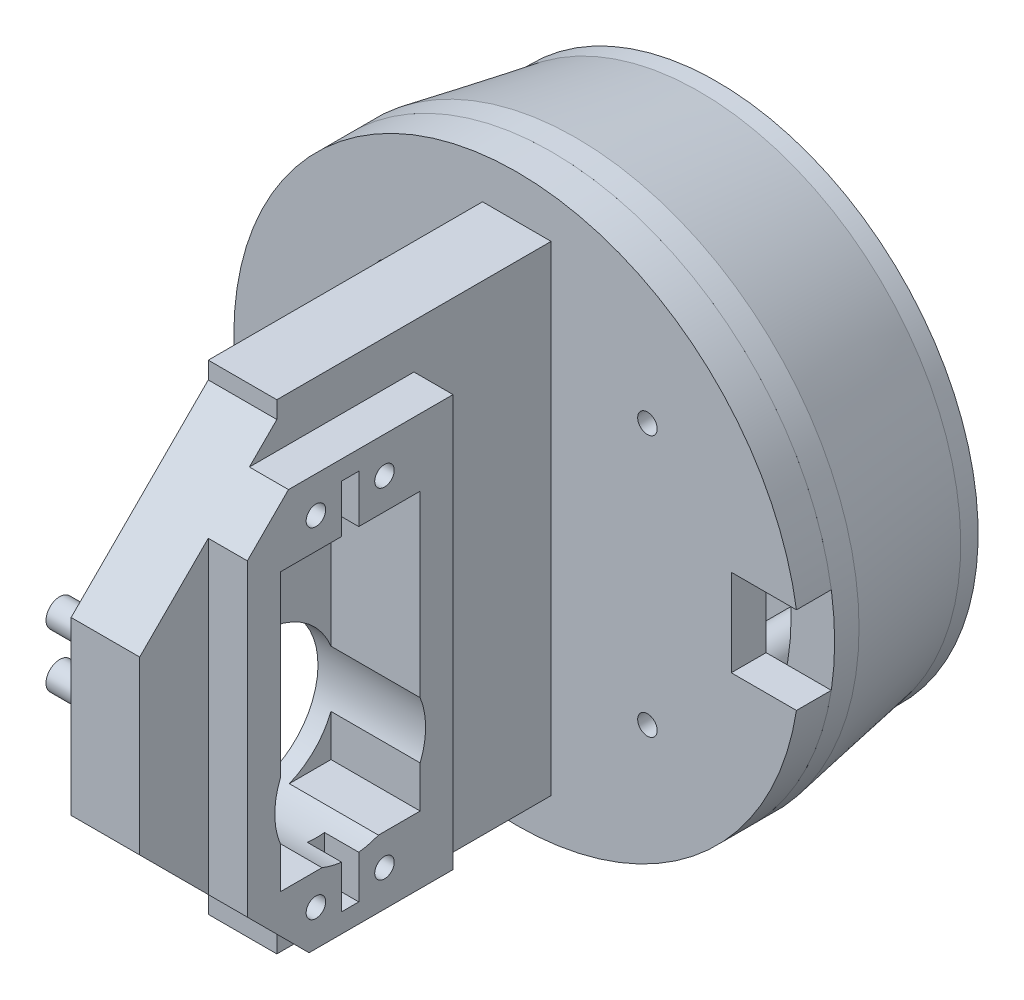
from build123d import *

# Parameters (mm, degrees)
SKETCH2_R                      = 41.27500000000001
SKETCH2_R_2                    = 34.925000000000004
BOSS_EXTRUDE1_DEPTH            = 3.555999999999654
SKETCH54_R                     = 41.27500000000001
SKETCH54_R_2                   = 34.92500000000001
BOSS_EXTRUDE2_DEPTH            = 25.4
BOSS_EXTRUDE2_TAPER            = 10.000000000000021
BOSS_EXTRUDE3_START            = -18.006319777
BOSS_EXTRUDE3_OUTLINE_R        = 38.1
BOSS_EXTRUDE3_DEPTH            = 3.81
BOSS_EXTRUDE5_REACH            = 72.778
SKETCH63_R                     = 3.175000000000002
SKETCH63_R_2                   = 3.175000000000009
SKETCH63_R_3                   = 3.1750000000000056
F_3_0MM_DOWEL_HOLE4_D          = 2.85
F_3_0MM_DOWEL_HOLE4_DEPTH      = 6.858
F_3_0MM_DOWEL_HOLE3_D          = 2.999994
CUT_EXTRUDE2_REACH             = 126.878
SKETCH58_W                     = 12.700000000000001
SKETCH58_H                     = 21.266668123278706
SKETCH60_R                     = 1.4249999999999978
SKETCH60_R_2                   = 1.4250000000000005
CUT_EXTRUDE4_DEPTH             = 70.71188168256496
SKETCH64_R                     = 1.425000000000001
SKETCH64_R_2                   = 1.4249999999999978
SKETCH64_R_3                   = 1.499996999999999
BOSS_EXTRUDE6_DEPTH            = 2.54
SKETCH67_R                     = 41.27500000000003
SKETCH67_R_2                   = 1.4249999999999985
SKETCH67_R_3                   = 1.4249999999999976
BOSS_EXTRUDE7_DEPTH            = 5.08
SKETCH68_W                     = 20
SKETCH68_H                     = 12.7
CUT_EXTRUDE5_DEPTH             = 5.08
BOSS_EXTRUDE8_START            = 11.43
SKETCH70_W                     = 70.00000000000001
SKETCH70_H                     = 70
BOSS_EXTRUDE8_DEPTH            = 5
BOSS_EXTRUDE9_DEPTH            = 5.699999999999999
CUT_EXTRUDE6_DEPTH             = 13
F_3_0MM_DOWEL_HOLE5_AT_2_COUNT = 2
F_3_0MM_DOWEL_HOLE5_AT_2_PITCH = 10
F_3_0MM_DOWEL_HOLE5_AT_3_COUNT = 2
F_3_0MM_DOWEL_HOLE5_AT_3_PITCH = 49.5
F_3_0MM_DOWEL_HOLE5_AT_4_COUNT = 2
F_3_0MM_DOWEL_HOLE5_AT_4_PITCH = 50.5
CUT_EXTRUDE7_DEPTH             = 100.24306365899265
CUT_EXTRUDE7_DEPTH_BACK        = 100.24306365899265
SKETCH76_R                     = 11
CUT_EXTRUDE9_DEPTH             = 5
SKETCH78_R                     = 2.5000000000000018
BOSS_EXTRUDE10_DEPTH           = 10
SKETCH79_R                     = 2.000000000000003
BOSS_EXTRUDE11_DEPTH           = 10
CUT_EXTRUDE10_DEPTH            = 101.45785526758407
CHAMFER1_SIZE                  = 1.27


with BuildPart() as part:
    # Sketch2 → Boss-Extrude1 (new body)
    with BuildSketch(Plane(origin=(0, 0.7215916123591171, 0), x_dir=(1, 0, 0), z_dir=(0, 0, 1))):
        with Locations((11.43, -1.4797279014976155)):
            Circle(SKETCH2_R)
        with Locations((11.43, -1.4797279014976155)):
            Circle(SKETCH2_R_2, mode=Mode.SUBTRACT)
    extrude(amount=BOSS_EXTRUDE1_DEPTH)

    # Sketch54 → Boss-Extrude2 (add)
    with BuildSketch(Plane(origin=(0, 0, 0), x_dir=(-1, 0, 0), z_dir=(0, 0, -1))):
        with Locations((-11.43, -0.7581362891384984)):
            Circle(SKETCH54_R)
        with Locations(Location((-11.43, -0.7581362891384984, 0), (0, 0, 180))):
            Circle(SKETCH54_R_2, mode=Mode.SUBTRACT)
    extrude(amount=BOSS_EXTRUDE2_DEPTH, taper=BOSS_EXTRUDE2_TAPER)

    # Boss-Extrude3: read off the stored shape, not the designer's step
    # Boss-Extrude3 outline → Boss-Extrude3 (add)
    with BuildSketch(Plane.XY.offset(BOSS_EXTRUDE3_START)):
        with Locations((11.43, -0.758136289)):
            Circle(BOSS_EXTRUDE3_OUTLINE_R)
    extrude(amount=BOSS_EXTRUDE3_DEPTH)

    # Sketch63 → Boss-Extrude5 (add, up to next)
    with BuildSketch(Plane.XY.offset(3.555999999999654), mode=Mode.PRIVATE) as boss_extrude5_sk1:
        with Locations((-7.620000000000005, 18.291863710861502)):
            Circle(SKETCH63_R)
    boss_extrude5_tool1 = extrude(boss_extrude5_sk1.sketch, amount=-BOSS_EXTRUDE5_REACH, mode=Mode.PRIVATE) - part.part
    # Sketch63 → Boss-Extrude5 (add, up to next)
    with BuildSketch(Plane.XY.offset(3.555999999999654), mode=Mode.PRIVATE) as boss_extrude5_sk2:
        with Locations((30.479999999999997, 18.29186371086151)):
            Circle(SKETCH63_R_2)
    boss_extrude5_tool2 = extrude(boss_extrude5_sk2.sketch, amount=-BOSS_EXTRUDE5_REACH, mode=Mode.PRIVATE) - part.part
    # Sketch63 → Boss-Extrude5 (add, up to next)
    with BuildSketch(Plane.XY.offset(3.555999999999654), mode=Mode.PRIVATE) as boss_extrude5_sk3:
        with Locations((30.480000000000004, -19.8081362891385)):
            Circle(SKETCH63_R_2)
    boss_extrude5_tool3 = extrude(boss_extrude5_sk3.sketch, amount=-BOSS_EXTRUDE5_REACH, mode=Mode.PRIVATE) - part.part
    # Sketch63 → Boss-Extrude5 (add, up to next)
    with BuildSketch(Plane.XY.offset(3.555999999999654), mode=Mode.PRIVATE) as boss_extrude5_sk4:
        with Locations((-7.620000000000005, -19.8081362891385)):
            Circle(SKETCH63_R_3)
    boss_extrude5_tool4 = extrude(boss_extrude5_sk4.sketch, amount=-BOSS_EXTRUDE5_REACH, mode=Mode.PRIVATE) - part.part
    add(boss_extrude5_tool1.solids().sort_by_distance((-7.62, 18.291864, 3.556))[0])
    add(boss_extrude5_tool2.solids().sort_by_distance((30.48, 18.291864, 3.556))[0])
    add(boss_extrude5_tool3.solids().sort_by_distance((30.48, -19.808136, 3.556))[0])
    add(boss_extrude5_tool4.solids().sort_by_distance((-7.62, -19.808136, 3.556))[0])

    # Ø3.0mm Dowel Hole4
    with Locations(Plane.XY.offset(3.555999999999654)):
        with Locations((-7.62, 18.291863711), (30.48, 18.291863711), (30.48, -19.808136289), (-7.62, -19.808136289)):
            Hole(F_3_0MM_DOWEL_HOLE4_D / 2, depth=F_3_0MM_DOWEL_HOLE4_DEPTH)

    # Ø3.0mm Dowel Hole3 (through all)
    with Locations(Plane(origin=(0, 0, -18.006319777286222), x_dir=(-1, 0, 0), z_dir=(0, 0, -1))):
        with Locations((-11.43, -0.758136289)):
            Hole(F_3_0MM_DOWEL_HOLE3_D / 2)

    # Cut-Extrude2: up to this cone (the profile starts outside it)
    cut_extrude2_end = Plane(origin=(11.43, -0.7581362891384984, -11.65632), z_dir=(0, 0, -1)) * Cone(7.999516737370435, 65.961130686173, 328.7166474235434, mode=Mode.PRIVATE)
    # Sketch58 → Cut-Extrude2 (cut, up to the surface)
    with BuildSketch(Plane(origin=(-63.5, 0, 0), x_dir=(0, 0, -1), z_dir=(1, 0, 0)), mode=Mode.PRIVATE) as cut_extrude2_sk1:
        with Locations((11.656319777286228, -0.08753137128510957)):
            Rectangle(SKETCH58_W, SKETCH58_H)
    cut_extrude2_tool1 = extrude(cut_extrude2_sk1.sketch, amount=CUT_EXTRUDE2_REACH, mode=Mode.PRIVATE) - cut_extrude2_end
    add(cut_extrude2_tool1.solids().sort_by_distance((-63.5, -0.087531, -11.65632))[0], mode=Mode.SUBTRACT)

    # Sketch60 → Cut-Extrude4 (cut, through all)
    with BuildSketch(Plane.XY.offset(-14.196319777286222)):
        with Locations((18.43, -0.7581362891384957)):
            Circle(SKETCH60_R)
        with Locations((4.429999999999999, -0.7581362891384984)):
            Circle(SKETCH60_R_2)
    extrude(amount=-CUT_EXTRUDE4_DEPTH, mode=Mode.SUBTRACT)

    # Sketch64 → Boss-Extrude6 (add)
    with BuildSketch(Plane(origin=(0, 0, -18.006319777286222), x_dir=(-1, 0, 0), z_dir=(0, 0, -1))):
        with BuildLine():
            ThreePointArc((25.344366452837203, -10.720865432924475), (26.663599038852283, -0.05977229582778121), (24.954487952256596, 10.545802690354252))
            ThreePointArc((24.954487952256596, 10.545802690354252), (-49.52359903885228, -1.4565002824492193), (25.344366452837203, -10.720865432924475))
        make_face()
        with Locations(Location((-4.429999999999999, -0.7581362891384984, 0), (0, 0, 180))):
            Circle(SKETCH64_R, mode=Mode.SUBTRACT)
        with Locations(Location((-18.43, -0.7581362891384957, 0), (0, 0, 180))):
            Circle(SKETCH64_R_2, mode=Mode.SUBTRACT)
        with Locations((-11.43, -0.7581362891384984)):
            Circle(SKETCH64_R_3, mode=Mode.SUBTRACT)
    extrude(amount=BOSS_EXTRUDE6_DEPTH)


with BuildPart() as body_2:
    # Sketch67 → Boss-Extrude7 (new body)
    with BuildSketch(Plane.XY.offset(3.555999999999654)):
        with Locations((11.43, -0.7581362891384984)):
            Circle(SKETCH67_R)
        with Locations((-7.620000000000005, -19.8081362891385)):
            Circle(SKETCH67_R_2, mode=Mode.SUBTRACT)
        with Locations((30.480000000000004, -19.8081362891385)):
            Circle(SKETCH67_R_3, mode=Mode.SUBTRACT)
        with Locations((30.479999999999997, 18.29186371086151)):
            Circle(SKETCH67_R_3, mode=Mode.SUBTRACT)
        with Locations((-7.620000000000005, 18.291863710861502)):
            Circle(SKETCH67_R_2, mode=Mode.SUBTRACT)
    extrude(amount=BOSS_EXTRUDE7_DEPTH)

    # Sketch68 → Cut-Extrude5 (cut)
    with BuildSketch(Plane.XY.offset(8.635999999999655)):
        with Locations((52.70500000000003, -0.7581362891385006)):
            Rectangle(SKETCH68_W, SKETCH68_H)
    extrude(amount=-CUT_EXTRUDE5_DEPTH, mode=Mode.SUBTRACT)

    # Sketch70 → Boss-Extrude8 (add, symmetric)
    with BuildSketch(Plane(origin=(0, 0, 0), x_dir=(0, 0, -1), z_dir=(1, 0, 0)).offset(BOSS_EXTRUDE8_START)):
        with Locations((-43.63599999999966, -0.7581362891384948)):
            Rectangle(SKETCH70_W, SKETCH70_H)
    extrude(amount=BOSS_EXTRUDE8_DEPTH, both=True)

    # Sketch71 → Boss-Extrude9 (add)
    with BuildSketch(Plane(origin=(16.43, 0, 0), x_dir=(0, 0, -1), z_dir=(1, 0, 0))):
        Polygon((-58.635999999999655, 27.741863710861526), (-28.635999999999655, 27.741863710861526), (-28.635999999999648, -32.25813628913847), (-58.63599999999963, -32.25813628913847), align=None)
    extrude(amount=BOSS_EXTRUDE9_DEPTH)

    # Sketch72 → Cut-Extrude6 (cut)
    with BuildSketch(Plane(origin=(22.13, 0, 0), x_dir=(0, 0, -1), z_dir=(1, 0, 0))):
        Polygon((-53.83599999999965, 17.94186371086152), (-33.435999999999645, 17.941863710861533), (-33.435999999999645, -22.458136289138466), (-53.83599999999965, -22.45813628913848), align=None)
    extrude(amount=-CUT_EXTRUDE6_DEPTH, mode=Mode.SUBTRACT)

    # Sketch75 → Ø3.0mm Dowel Hole5 (revolve, cut)
    with BuildSketch(Plane(origin=(22.13, -27.00813628913847, 38.63599999999965), x_dir=(0, 0, -1), z_dir=(0, 1, 0))):
        Polygon((0, 0), (-3.85e-15, 15.700000000000003), (1.4249999999999974, 15.700000000000003), (1.4249999999999994, -1e-17), align=None)
    f_3_0mm_dowel_hole5 = revolve(axis=Axis((28.47999999999999, -27.00813628913847, 38.63599999999965), (-1, 0, 0)), mode=Mode.SUBTRACT)

    # Ø3.0mm Dowel Hole5 at 2: Ø3.0mm Dowel Hole5 ×2
    with Locations(*[(0, 0, i * F_3_0MM_DOWEL_HOLE5_AT_2_PITCH) for i in range(1, F_3_0MM_DOWEL_HOLE5_AT_2_COUNT)]):
        add(f_3_0mm_dowel_hole5, mode=Mode.SUBTRACT)

    # Ø3.0mm Dowel Hole5 at 3: Ø3.0mm Dowel Hole5 ×2
    with Locations(*[(0, i * F_3_0MM_DOWEL_HOLE5_AT_3_PITCH, 0) for i in range(1, F_3_0MM_DOWEL_HOLE5_AT_3_COUNT)]):
        add(f_3_0mm_dowel_hole5, mode=Mode.SUBTRACT)

    # Ø3.0mm Dowel Hole5 at 4: Ø3.0mm Dowel Hole5 ×2
    with Locations(*[Vector(0, 0.9801980198019803, 0.19801980198019806) * (i * F_3_0MM_DOWEL_HOLE5_AT_4_PITCH) for i in range(1, F_3_0MM_DOWEL_HOLE5_AT_4_COUNT)]):
        add(f_3_0mm_dowel_hole5, mode=Mode.SUBTRACT)

    # Sketch76 → Cut-Extrude7 (cut, two sides: drawn at the far end of the back side and taken through both)
    with BuildSketch(Plane(origin=(9.13, 0, 0), x_dir=(0, 0, -1), z_dir=(1, 0, 0)).offset(-CUT_EXTRUDE7_DEPTH_BACK)):
        with Locations(Location((-43.63599999999964, -12.258136289138482, 0), (0, 0, 338.013597003))):
            Circle(SKETCH76_R)
    extrude(amount=CUT_EXTRUDE7_DEPTH + CUT_EXTRUDE7_DEPTH_BACK, mode=Mode.SUBTRACT)

    # Sketch77 → Cut-Extrude9 (cut)
    with BuildSketch(Plane(origin=(22.13, 0, 0), x_dir=(0, 0, -1), z_dir=(1, 0, 0))):
        Polygon((-44.88599999999964, 24.941863710861522), (-42.38599999999964, 24.94186371086152), (-42.38599999999965, 17.941863710861515), (-44.88599999999963, 17.941863710861515), align=None)
        Polygon((-44.88599999999964, -29.458136289138476), (-42.38599999999965, -29.458136289138476), (-42.38599999999964, -22.45813628913848), (-44.88599999999964, -22.45813628913848), align=None)
    extrude(amount=-CUT_EXTRUDE9_DEPTH, mode=Mode.SUBTRACT)

    # Sketch78 → Boss-Extrude10 (add)
    with BuildSketch(Plane.ZY.offset(-6.429999999999999)):
        with Locations((43.63599999999964, 10.741863710861484)):
            Circle(SKETCH78_R)
    extrude(amount=BOSS_EXTRUDE10_DEPTH)

    # Sketch79 → Boss-Extrude11 (add)
    with BuildSketch(Plane.ZY.offset(-6.429999999999999)):
        with Locations((60.30111511679786, 3.2102714393784137)):
            Circle(SKETCH79_R)
        with Locations(Location((60.30111511679786, -4.726544017655412, 0), (0, 0, 180))):
            Circle(SKETCH79_R)
    extrude(amount=BOSS_EXTRUDE11_DEPTH)

    # Sketch80 → Cut-Extrude10 (cut, through all)
    with BuildSketch(Plane.ZY.offset(-6.429999999999999)):
        Polygon((78.63599999999967, 34.24186371086151), (48.63599999999967, 34.24186371086151), (48.63599999999967, 31.741863710861587), (68.63599999999967, 11.741863710861503), (68.63599999999967, -13.258136289138498), (48.63599999999967, -33.258136289138584), (48.63599999999967, -35.7581362891385), (78.63599999999967, -35.7581362891385), align=None)
    extrude(amount=-CUT_EXTRUDE10_DEPTH, mode=Mode.SUBTRACT)

    # Chamfer1
    chamfer1_edges = [body_2.edges().sort_by_distance(p)[0] for p in [
        (6.429999999999999, 10.741863710861484, 41.13599999999964),
        (6.429999999999999, 3.210271439378414, 58.30111511679786),
        (6.429999999999999, -4.726544017655413, 62.30111511679786),
    ]]
    chamfer(chamfer1_edges, length=CHAMFER1_SIZE)


solid = Compound([part.part, body_2.part])
